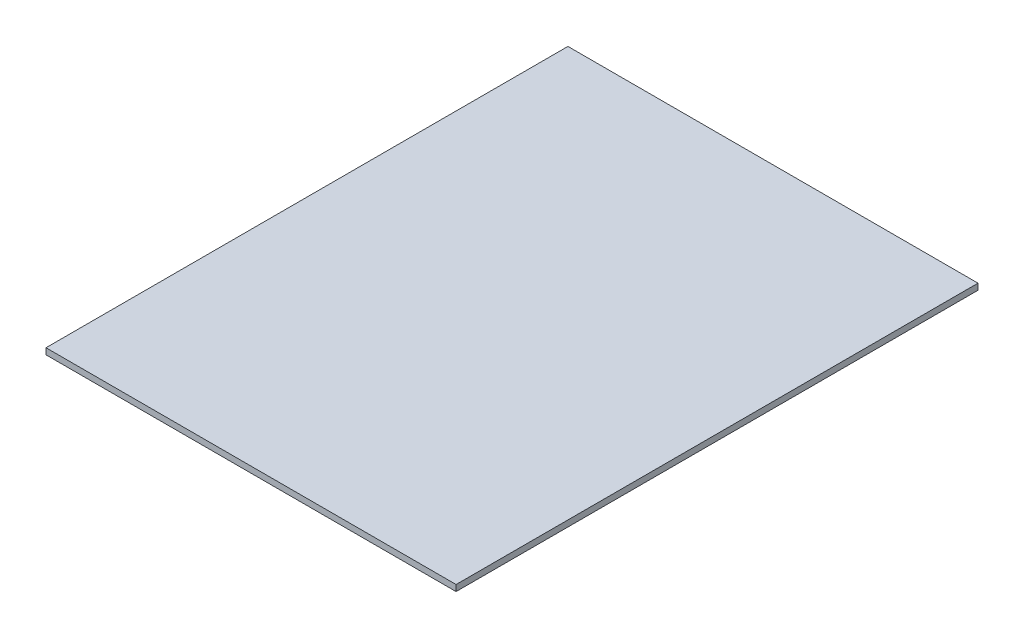
from build123d import *

# Parameters (mm, degrees)
SKETCH1_W           = 110
SKETCH1_H           = 140
BOSS_EXTRUDE1_DEPTH = 1.65


with BuildPart() as part:
    # Sketch1 → Boss-Extrude1 (new body)
    with BuildSketch(Plane(origin=(0, 0, 0), x_dir=(1, 0, 0), z_dir=(0, 1, 0))):
        Rectangle(SKETCH1_W, SKETCH1_H)
    extrude(amount=BOSS_EXTRUDE1_DEPTH)


solid = part.part
